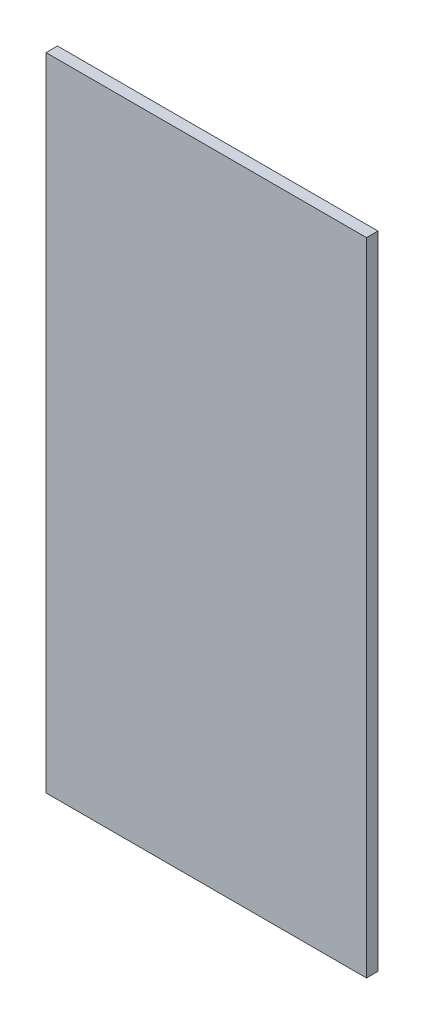
from build123d import *

# Parameters (mm, degrees)
SKETCH1_W           = 533.146
SKETCH1_H           = 1066.799994849
BOSS_EXTRUDE1_DEPTH = 19.05


with BuildPart() as part:
    # Sketch1 → Boss-Extrude1 (new body)
    with BuildSketch(Plane.XY):
        with Locations((0, 6469.379997497)):
            Rectangle(SKETCH1_W, SKETCH1_H)
    extrude(amount=-BOSS_EXTRUDE1_DEPTH)


solid = part.part
